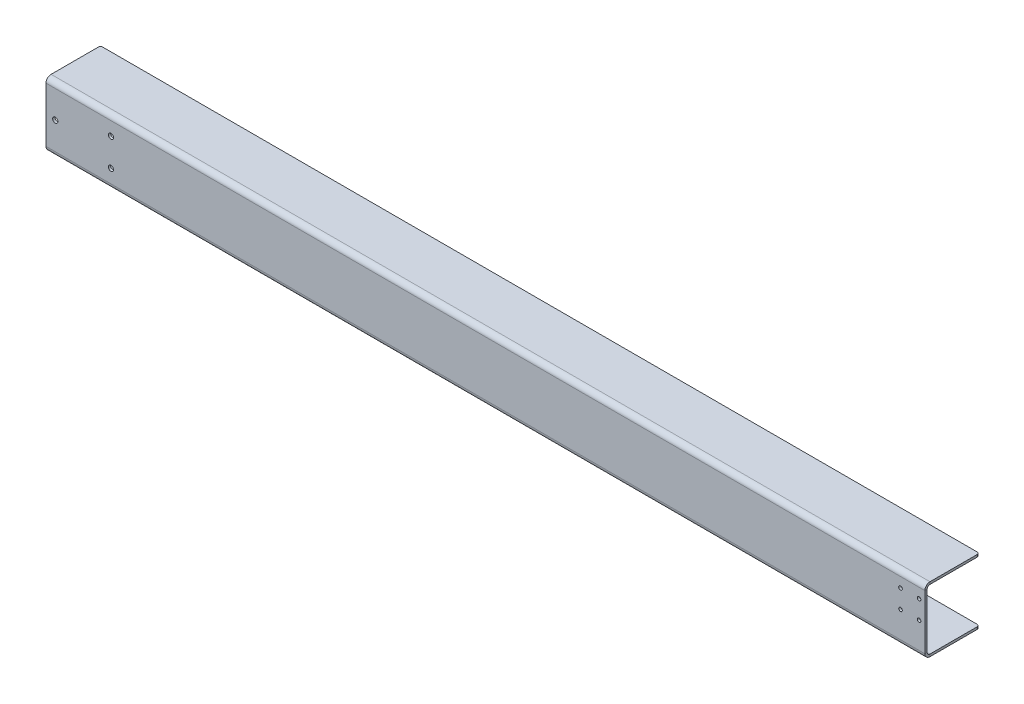
from build123d import *

# Parameters (mm, degrees)
SKETCH1_W                           = 1209.675
SKETCH1_H                           = 74.6125
BASE_FLANGE1_DEPTH                  = 3.175
EDGE_FLANGE1_STRIP_W                = 20.32
EDGE_FLANGE1_STRIP_H                = 3.175
EDGE_FLANGE1_STRIP_CUT_DEPTH        = 1209.675
EDGE_FLANGE1_DEPTH                  = 1209.675
EDGE_FLANGE2_STRIP_W                = 20.32
EDGE_FLANGE2_STRIP_H                = 3.175
EDGE_FLANGE2_STRIP_CUT_DEPTH        = 1209.675
EDGE_FLANGE2_DEPTH                  = 1209.675
F_9_32_0_28125_DIAMETER_HOLE3_D     = 7.14375
F_9_32_0_28125_DIAMETER_HOLE3_DEPTH = 3.175
F_9_32_0_28125_DIAMETER_HOLE2_D     = 7.14375
F_9_32_0_28125_DIAMETER_HOLE1_D     = 7.14375
F_9_32_0_28125_DIAMETER_HOLE1_DEPTH = 3.175
O_0_316_DIAMETER_SLOT1_DEPTH        = 3.175
LPATTERN1_COUNT                     = 3
LPATTERN1_PITCH                     = 39.6875
F_10_0_1935_DIAMETER_HOLE1_D        = 4.9149
LPATTERN2_COUNT                     = 2
LPATTERN2_PITCH                     = 25.4
LPATTERN2_COUNT_DIR2                = 2
LPATTERN2_PITCH_DIR2                = 25.4
SKETCH23_W                          = 6.35
SKETCH23_H                          = 88.9
CUT_EXTRUDE1_DEPTH                  = 616.872256692
FILLET1_R                           = 3.175


# Read off the part's stored shape, not the designer's step: O (0.316) Diameter Slot1
# Sheet-metal steps are written as plain solids
with BuildPart() as part:
    # Sketch1 → Base-Flange1 (new body)
    with BuildSketch(Plane(origin=(0, 0, 0), x_dir=(1, 0, 0), z_dir=(0, 1, 0))):
        Rectangle(SKETCH1_W, SKETCH1_H)
    extrude(amount=BASE_FLANGE1_DEPTH)

    # Edge-Flange1 strip (across the edge) → Edge-Flange1 strip cut (cut)
    with BuildSketch(Plane(origin=(-604.8375, 3.175, 37.30625), x_dir=(0, 0, -1), z_dir=(1, 0, 0))):
        with Locations((-3.175, -1.5875)):
            Rectangle(EDGE_FLANGE1_STRIP_W, EDGE_FLANGE1_STRIP_H)
    extrude(amount=EDGE_FLANGE1_STRIP_CUT_DEPTH, mode=Mode.SUBTRACT)

    # Edge-Flange1 section (across the edge) → Edge-Flange1 (add)
    with BuildSketch(Plane(origin=(-604.8375, 3.175, 37.30625), x_dir=(0, 0, -1), z_dir=(1, 0, 0))):
        with BuildLine():
            Line((0, 3.81), (0, 85.725))
            Line((0, 85.725), (3.175, 85.725))
            Line((3.175, 85.725), (3.175, 3.81))
            ThreePointArc((3.175, 3.81), (4.290923164, 1.115923164), (6.985, 0))
            Line((6.985, 0), (6.985, -3.175))
            ThreePointArc((6.985, -3.175), (2.045859133, -1.129140867), (0, 3.81))
        make_face()
    extrude(amount=EDGE_FLANGE1_DEPTH)

    # Edge-Flange2 strip (across the edge) → Edge-Flange2 strip cut (cut)
    with BuildSketch(Plane(origin=(-604.8375, 88.9, 34.13125), x_dir=(0, -1, 0), z_dir=(1, 0, 0))):
        with Locations((-3.175, -1.5875)):
            Rectangle(EDGE_FLANGE2_STRIP_W, EDGE_FLANGE2_STRIP_H)
    extrude(amount=EDGE_FLANGE2_STRIP_CUT_DEPTH, mode=Mode.SUBTRACT)

    # Edge-Flange2 section (across the edge) → Edge-Flange2 (add)
    with BuildSketch(Plane(origin=(-604.8375, 88.9, 34.13125), x_dir=(0, -1, 0), z_dir=(1, 0, 0))):
        with BuildLine():
            Line((0, 3.81), (0, 71.4375))
            Line((0, 71.4375), (3.175, 71.4375))
            Line((3.175, 71.4375), (3.175, 3.81))
            ThreePointArc((3.175, 3.81), (4.290923164, 1.115923164), (6.985, 0))
            Line((6.985, 0), (6.985, -3.175))
            ThreePointArc((6.985, -3.175), (2.045859133, -1.129140867), (0, 3.81))
        make_face()
    extrude(amount=EDGE_FLANGE2_DEPTH)

    # 9/32 (0.28125) Diameter Hole3
    with Locations(Plane(origin=(0, 0, 0), x_dir=(-1, 0, 0), z_dir=(0, -1, 0))):
        with Locations((-482.6, -13.49375), (-482.6, 24.60625)):
            f_9_32_0_28125_diameter_hole3 = Hole(F_9_32_0_28125_DIAMETER_HOLE3_D / 2, depth=F_9_32_0_28125_DIAMETER_HOLE3_DEPTH)

    # 9/32 (0.28125) Diameter Hole2 (through all)
    with Locations(Plane.XY.offset(37.30625)):
        with Locations((-592.1375, 44.45), (-515.9375, 63.5), (-515.9375, 25.4)):
            Hole(F_9_32_0_28125_DIAMETER_HOLE2_D / 2)

    # 9/32 (0.28125) Diameter Hole1
    with Locations(Plane(origin=(0, 0, 0), x_dir=(-1, 0, 0), z_dir=(0, -1, 0))):
        with Locations((592.1375, 5.55625), (515.9375, -13.49375), (515.9375, 24.60625)):
            Hole(F_9_32_0_28125_DIAMETER_HOLE1_D / 2, depth=F_9_32_0_28125_DIAMETER_HOLE1_DEPTH)

    # O (0.316) Diameter Slot1 outline → O (0.316) Diameter Slot1 (cut)
    with BuildSketch(Plane(origin=(0, 0, 0), x_dir=(1, 0, 0), z_dir=(0, 1, 0))):
        with BuildLine():
            ThreePointArc((138.39825, 3.20675), (116.68125, 24.92375), (94.96425, 3.20675))
            Line((94.96425, 3.20675), (94.96425, -1.61925))
            ThreePointArc((94.96425, -1.61925), (116.68125, -23.33625), (138.39825, -1.61925))
            Line((138.39825, -1.61925), (138.39825, 3.20675))
        make_face()
        with BuildLine():
            ThreePointArc((-342.61425, 3.20675), (-364.33125, 24.92375), (-386.04825, 3.20675))
            Line((-386.04825, 3.20675), (-386.04825, -1.61925))
            ThreePointArc((-386.04825, -1.61925), (-364.33125, -23.33625), (-342.61425, -1.61925))
            Line((-342.61425, -1.61925), (-342.61425, 3.20675))
        make_face()
    extrude(amount=O_0_316_DIAMETER_SLOT1_DEPTH, mode=Mode.SUBTRACT)

    # LPattern1: 9/32 (0.28125) Diameter Hole3 ×3
    with Locations(*[(-i * LPATTERN1_PITCH, 0, 0) for i in range(1, LPATTERN1_COUNT)]):
        add(f_9_32_0_28125_diameter_hole3, mode=Mode.SUBTRACT)

    # #10 (0.1935) Diameter Hole1 (through all)
    with Locations(Plane.XY.offset(37.30625)):
        with Locations((590.55, 68.2625)):
            f_10_0_1935_diameter_hole1 = Hole(F_10_0_1935_DIAMETER_HOLE1_D / 2)

    # LPattern2: 10 _0.1935_ Diameter Hole1 2 × 2
    with Locations(*[(-i * LPATTERN2_PITCH, -j * LPATTERN2_PITCH_DIR2, 0) for i in range(LPATTERN2_COUNT) for j in range(LPATTERN2_COUNT_DIR2) if (i, j) != (0, 0)]):
        add(f_10_0_1935_diameter_hole1, mode=Mode.SUBTRACT)

    # Sketch23 → Cut-Extrude1 (cut, through all)
    with BuildSketch(Plane.XY.offset(37.30625)):
        with Locations((601.6625, 44.45)):
            Rectangle(SKETCH23_W, SKETCH23_H)
    extrude(amount=-CUT_EXTRUDE1_DEPTH, mode=Mode.SUBTRACT)

    # Fillet1
    fillet1_edges = [part.edges().sort_by_distance(p)[0] for p in [
        (-604.8375, 1.5875, -37.30625),
        (-604.8375, 87.3125, -37.30625),
        (598.4875, 1.5875, -37.30625),
        (598.4875, 87.3125, -37.30625),
    ]]
    fillet(fillet1_edges, radius=FILLET1_R)


solid = part.part
